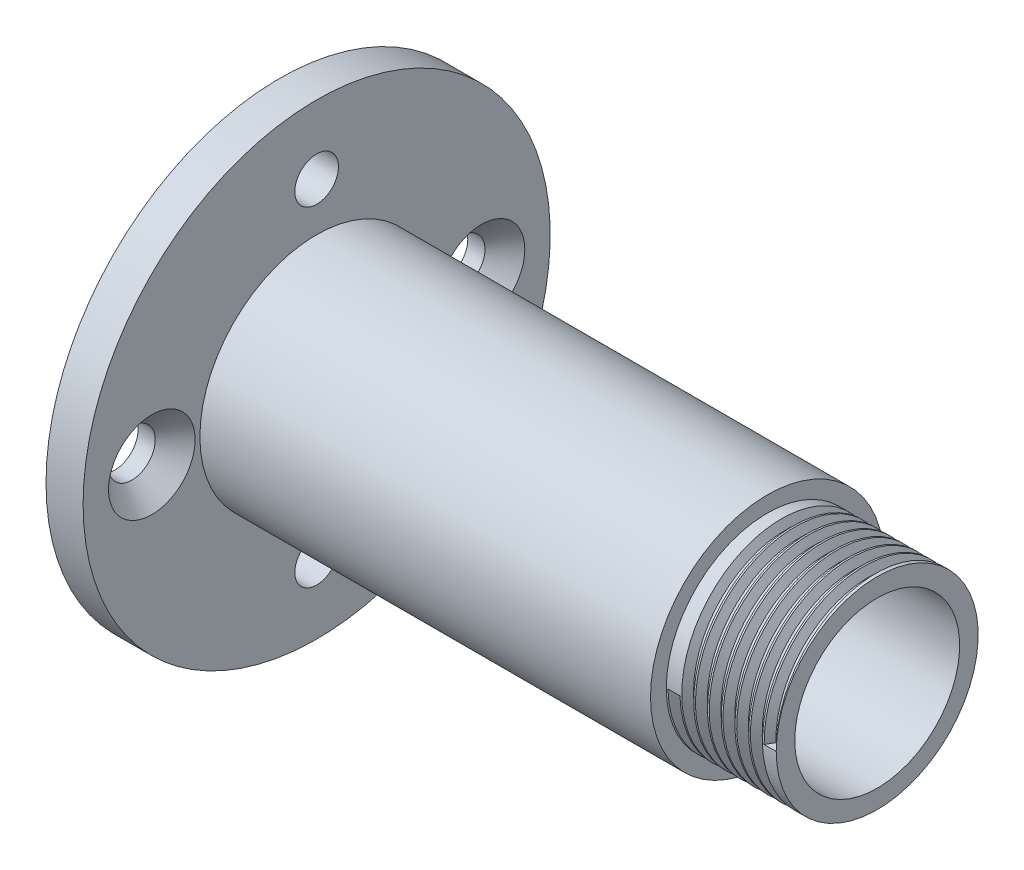
from build123d import *

# Parameters (mm, degrees)
CUT_EXTRUDE1_REACH                                  = 173.372
SKETCH4_R                                           = 1.5875
CSK_FOR_M3_COUNTERSUNK_FLAT_HEAD_SCREW1_D           = 3.4
CSK_FOR_M3_COUNTERSUNK_FLAT_HEAD_SCREW1_DEPTH       = 10
CSK_FOR_M3_COUNTERSUNK_FLAT_HEAD_SCREW1_CSINK_D     = 6.3
CSK_FOR_M3_COUNTERSUNK_FLAT_HEAD_SCREW1_CSINK_ANGLE = 90
CSK_FOR_M3_COUNTERSUNK_FLAT_HEAD_SCREW1_TIP         = 1.021463052
CUT_EXTRUDE2_START                                  = -1
SKETCH13_R                                          = 6
CUT_EXTRUDE2_DEPTH                                  = 1
CUT_EXTRUDE3_START                                  = -10
SKETCH14_R                                          = 6
CUT_EXTRUDE3_DEPTH                                  = 10
THREAD1_PITCH                                       = 1


with BuildPart() as part:
    # Sketch3 → Revolve19 (revolve)
    with BuildSketch(Plane.XY, mode=Mode.PRIVATE) as revolve19_sk:
        Polygon((297.058388758, -140.073704322), (264.258388758, -140.073704322), (264.258388758, -131.573704322), (261.558388758, -131.573704322), (261.558388758, -143.323704322), (261.558388758, -144.823704322), (262.558388758, -144.823704322), (264.258388758, -144.823704322), (264.258388758, -142.573704322), (305.058388758, -142.573704322), (305.058388758, -141.223704322), (297.058388758, -141.223704322), align=None)
    revolve(revolve19_sk.sketch.rotate(Axis((227.370475166, -148.573704322, 0), (1, 0, 0)), 90), axis=Axis((227.370475166, -148.573704322, 0), (1, 0, 0)))

    # Sketch4 → Cut-Extrude1 (cut, up to next)
    with BuildSketch(Plane(origin=(264.258388758, 0, 0), x_dir=(0, 0, -1), z_dir=(1, 0, 0)), mode=Mode.PRIVATE) as cut_extrude1_sk1:
        with Locations((0, -136.573704322)):
            Circle(SKETCH4_R)
    cut_extrude1_tool1 = extrude(cut_extrude1_sk1.sketch, amount=-CUT_EXTRUDE1_REACH, mode=Mode.PRIVATE) & part.part
    # Sketch4 → Cut-Extrude1 (cut, up to next)
    with BuildSketch(Plane(origin=(264.258388758, 0, 0), x_dir=(0, 0, -1), z_dir=(1, 0, 0)), mode=Mode.PRIVATE) as cut_extrude1_sk2:
        with Locations((0, -160.573704322)):
            Circle(SKETCH4_R)
    cut_extrude1_tool2 = extrude(cut_extrude1_sk2.sketch, amount=-CUT_EXTRUDE1_REACH, mode=Mode.PRIVATE) & part.part
    add(cut_extrude1_tool1.solids().sort_by_distance((264.258389, -136.573704, 0))[0], mode=Mode.SUBTRACT)
    add(cut_extrude1_tool2.solids().sort_by_distance((264.258389, -160.573704, 0))[0], mode=Mode.SUBTRACT)

    # CSK for M3 Countersunk Flat Head Screw1
    with Locations(Plane(origin=(264.258388758, 0, 0), x_dir=(0, 0, -1), z_dir=(1, 0, 0))):
        with Locations((12, -148.573704322), (-12, -148.573704322)):
            CounterSinkHole(CSK_FOR_M3_COUNTERSUNK_FLAT_HEAD_SCREW1_D / 2, CSK_FOR_M3_COUNTERSUNK_FLAT_HEAD_SCREW1_CSINK_D / 2, depth=CSK_FOR_M3_COUNTERSUNK_FLAT_HEAD_SCREW1_DEPTH, counter_sink_angle=CSK_FOR_M3_COUNTERSUNK_FLAT_HEAD_SCREW1_CSINK_ANGLE)
            with Locations((0, 0, -(CSK_FOR_M3_COUNTERSUNK_FLAT_HEAD_SCREW1_DEPTH + CSK_FOR_M3_COUNTERSUNK_FLAT_HEAD_SCREW1_TIP / 2))):  # 118° drill point
                Cone(0, CSK_FOR_M3_COUNTERSUNK_FLAT_HEAD_SCREW1_D / 2, CSK_FOR_M3_COUNTERSUNK_FLAT_HEAD_SCREW1_TIP, mode=Mode.SUBTRACT)

    # Sketch13 → Cut-Extrude2 (cut)
    with BuildSketch(Plane.ZY.offset(-261.558388758).offset(CUT_EXTRUDE2_START)):
        with Locations((0, -148.573704322)):
            Circle(SKETCH13_R)
    extrude(amount=CUT_EXTRUDE2_DEPTH, mode=Mode.SUBTRACT)

    # Sketch14 → Cut-Extrude3 (cut)
    with BuildSketch(Plane.ZY.offset(-262.558388758).offset(CUT_EXTRUDE3_START)):
        with Locations((0, -148.573704322)):
            Circle(SKETCH14_R)
    extrude(amount=CUT_EXTRUDE3_DEPTH, mode=Mode.SUBTRACT)

    # Thread1: arcs per turn and ends read off the stored shape
    # Thread1: the profile of Thread Profile1 profile screwed along a right-hand helix through 7 turns, 8 arcs to a turn; built about Z, then put on its axis
    thread1_z = Axis((0, 0, 0), (0, 0, 1))
    thread1_corners = [(7.3503, 0, -0.000173205), (7.3503, 0, 0.875173203), (6.808734125, 0, 0.562499999), (6.808734125, 0, 0.312499999)]
    with BuildLine(mode=Mode.PRIVATE) as thread1_profile:
        Line(thread1_corners[0], thread1_corners[1])
        Line(thread1_corners[1], thread1_corners[2])
        Line(thread1_corners[2], thread1_corners[3])
        Line(thread1_corners[3], thread1_corners[0])
    thread1_cap = Face(thread1_profile.wire())
    thread1_turn_angles = [0, 22.5, 45, 67.5, 90, 112.5, 135, 157.5, 180, 202.5, 225, 247.5, 270, 292.5, 315, 337.5, 360]
    thread1_turn_weights = [1, 0.9238795325112867, 1, 0.9238795325112867, 1, 0.9238795325112867, 1, 0.9238795325112867, 1, 0.9238795325112867, 1, 0.9238795325112867, 1, 0.9238795325112867, 1, 0.9238795325112867, 1]
    thread1_turn_rails = [Edge.make_bspline([Vector(p[0], p[1], 0).rotate(thread1_z, thread1_turn_angles[k]) / thread1_turn_weights[k] + Vector(0, 0, p[2] + THREAD1_PITCH * thread1_turn_angles[k] / 360) for k in range(17)], [0, 0, 0, 1, 1, 2, 2, 3, 3, 4, 4, 5, 5, 6, 6, 7, 7, 8, 8, 8], 2, thread1_turn_weights) for p in thread1_corners]
    thread1_turn_sides = [Face.make_surface_from_curves(thread1_turn_rails[p[0]], thread1_turn_rails[p[1]]) for p in [(0, 1), (1, 2), (2, 3), (3, 0)]]
    thread1 = Plane(origin=(305.058388758, -148.573704322, 0), x_dir=(0, 0, 1), z_dir=(-1, 0, 0)) * Solid(Shell([*[p.moved(Location((0, 0, THREAD1_PITCH * i))) for i in range(7) for p in thread1_turn_sides], thread1_cap, thread1_cap.rotate(thread1_z, 2520).moved(Location((0, 0, THREAD1_PITCH * 2520 / 360)))]))
    add(thread1, mode=Mode.SUBTRACT)


solid = part.part
